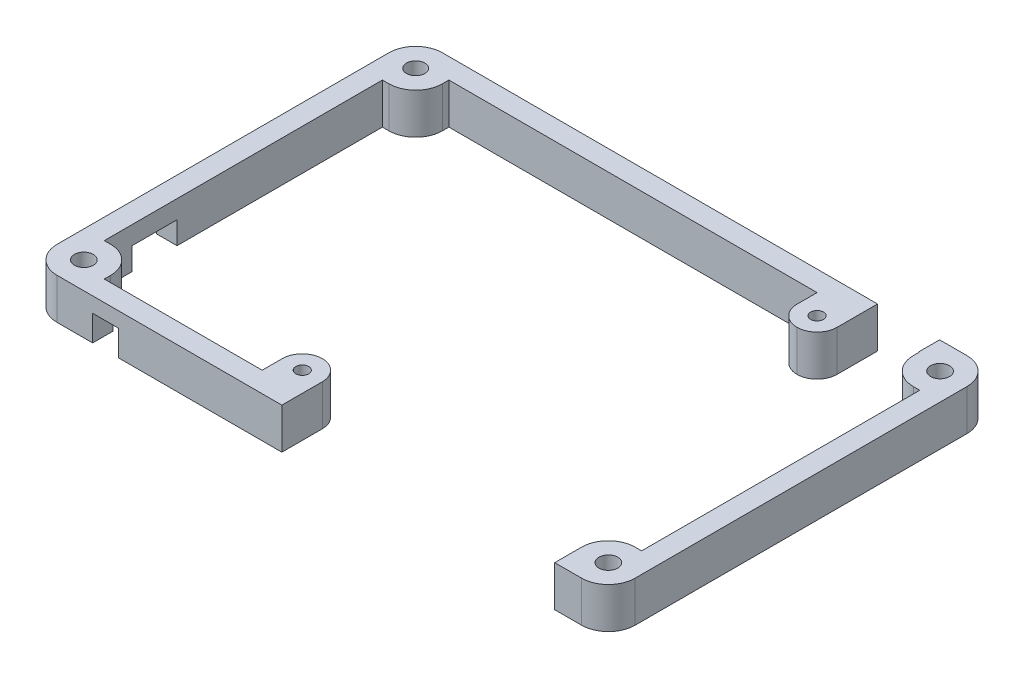
from build123d import *

# Parameters (mm, degrees)
BOSS_EXTRUDE3_DEPTH = 6.35
SKETCH3_W           = 9.663283239
SKETCH3_H           = 6.35
CUT_EXTRUDE1_DEPTH  = 3.175
SKETCH4_W           = 42.475
SKETCH4_H           = 6.35
CUT_EXTRUDE2_DEPTH  = 8.35
SKETCH5_W           = 7
SKETCH5_H           = 7
CUT_EXTRUDE3_DEPTH  = 3.175
SKETCH6_R           = 1.4732
CUT_EXTRUDE4_DEPTH  = 6.35
SKETCH7_R           = 1.4224
SKETCH7_R_2         = 1.4732
CUT_EXTRUDE5_DEPTH  = 6.35
SKETCH8_W           = 6.24
SKETCH8_H           = 6.35
BOSS_EXTRUDE4_DEPTH = 6.24
SKETCH9_W           = 6.24
SKETCH9_H           = 6.35
BOSS_EXTRUDE5_DEPTH = 6.24
SKETCH10_R          = 1
CUT_EXTRUDE6_DEPTH  = 55.454774814
FILLET1_R           = 3.12
SKETCH11_W          = 4
SKETCH11_H          = 4
CUT_EXTRUDE7_DEPTH  = 10


with BuildPart() as part:
    # Sketch2 → Boss-Extrude3 (new body)
    with BuildSketch(Plane(origin=(0, 0, 0), x_dir=(1, 0, 0), z_dir=(0, 1, 0))):
        with BuildLine():
            Line((-45, 25.825), (-45, -25.825))
            ThreePointArc((-45, -25.825), (-43.777170811, -28.777170811), (-40.825, -30))
            Line((-40.825, -30), (40.825, -30))
            ThreePointArc((40.825, -30), (43.777170811, -28.777170811), (45, -25.825))
            Line((45, -25.825), (45, 25.825))
            ThreePointArc((45, 25.825), (43.777170811, 28.777170811), (40.825, 30))
            Line((40.825, 30), (-40.825, 30))
            ThreePointArc((-40.825, 30), (-43.777170811, 28.777170811), (-45, 25.825))
        make_face()
        with BuildLine():
            Line((40.825, 21.65), (41.825, 21.65))
            Line((41.825, 21.65), (41.825, -21.65))
            Line((41.825, -21.65), (40.825, -21.65))
            ThreePointArc((40.825, -21.65), (37.872829189, -22.872829189), (36.65, -25.825))
            Line((36.65, -25.825), (36.65, -26.825))
            Line((36.65, -26.825), (-36.65, -26.825))
            Line((-36.65, -26.825), (-36.65, -25.825))
            ThreePointArc((-36.65, -25.825), (-37.872829189, -22.872829189), (-40.825, -21.65))
            Line((-40.825, -21.65), (-41.825, -21.65))
            Line((-41.825, -21.65), (-41.825, 21.65))
            Line((-41.825, 21.65), (-40.825, 21.65))
            ThreePointArc((-40.825, 21.65), (-37.872829189, 22.872829189), (-36.65, 25.825))
            Line((-36.65, 25.825), (-36.65, 26.825))
            Line((-36.65, 26.825), (36.65, 26.825))
            Line((36.65, 26.825), (36.65, 25.825))
            ThreePointArc((36.65, 25.825), (37.872829189, 22.872829189), (40.825, 21.65))
        make_face(mode=Mode.SUBTRACT)
    extrude(amount=BOSS_EXTRUDE3_DEPTH)

    # Sketch3 → Cut-Extrude1 (cut)
    with BuildSketch(Plane(origin=(0, 0, -30), x_dir=(-1, 0, 0), z_dir=(0, 0, -1))):
        with Locations((-31.734329903, 3.175)):
            Rectangle(SKETCH3_W, SKETCH3_H)
    extrude(amount=-CUT_EXTRUDE1_DEPTH, mode=Mode.SUBTRACT)

    # Sketch4 → Cut-Extrude2 (cut)
    with BuildSketch(Plane.XY.offset(30)):
        with Locations((15.4125, 3.175)):
            Rectangle(SKETCH4_W, SKETCH4_H)
    extrude(amount=-CUT_EXTRUDE2_DEPTH, mode=Mode.SUBTRACT)


with BuildPart() as cut_extrude2_piece_1:
    # of the separate pieces the step leaves, piece 1, a body of its own (cut_extrude2_pieces)
    add(part.part.solids().sort_by_distance((-40.825, 0, 30))[0])

    # Sketch5 → Cut-Extrude3 (cut)
    with BuildSketch(Plane.ZY.offset(45)):
        with Locations((13.825, 0)):
            Rectangle(SKETCH5_W, SKETCH5_H)
    extrude(amount=-CUT_EXTRUDE3_DEPTH, mode=Mode.SUBTRACT)

    # Sketch7 → Cut-Extrude5 (cut)
    with BuildSketch(Plane.XZ):
        with Locations(Location((-40.825, -25.825, 0), (0, 0, 270))):
            Circle(SKETCH7_R)
        with Locations(Location((-40.825, 25.825, 0), (0, 0, 270))):
            Circle(SKETCH7_R_2)
    extrude(amount=-CUT_EXTRUDE5_DEPTH, mode=Mode.SUBTRACT)

    # Sketch8 → Boss-Extrude4 (add)
    with BuildSketch(Plane(origin=(0, 0, 26.825), x_dir=(-1, 0, 0), z_dir=(0, 0, -1))):
        with Locations((8.945, 3.175)):
            Rectangle(SKETCH8_W, SKETCH8_H)
    extrude(amount=BOSS_EXTRUDE4_DEPTH)

    # Sketch9 → Boss-Extrude5 (add)
    with BuildSketch(Plane.XY.offset(-26.825)):
        with Locations((23.782688283, 3.175)):
            Rectangle(SKETCH9_W, SKETCH9_H)
    extrude(amount=BOSS_EXTRUDE5_DEPTH)

    # Sketch10 → Cut-Extrude6 (cut, through all)
    with BuildSketch(Plane(origin=(0, 0, 0), x_dir=(-1, 0, 0), z_dir=(0, -1, 0))):
        with Locations(Location((-23.782688283, 23.705, 0), (0, 0, 90))):
            Circle(SKETCH10_R)
        with Locations(Location((8.945, -23.705, 0), (0, 0, 90))):
            Circle(SKETCH10_R)
    extrude(amount=-CUT_EXTRUDE6_DEPTH, mode=Mode.SUBTRACT)

    # Fillet1
    fillet1_edges = [cut_extrude2_piece_1.edges().sort_by_distance(p)[0] for p in [
        (-12.065, 3.175, 20.585),
        (-5.825, 3.175, 20.585),
        (26.902688283, 3.175, -20.585),
        (20.662688283, 3.175, -20.585),
    ]]
    fillet(fillet1_edges, radius=FILLET1_R - 0.0001)  # a hair under: the kernel refuses the full size

    # Sketch11 → Cut-Extrude7 (cut)
    with BuildSketch(Plane.XY.offset(30)):
        with Locations((-33.285, 2)):
            Rectangle(SKETCH11_W, SKETCH11_H)
    extrude(amount=-CUT_EXTRUDE7_DEPTH, mode=Mode.SUBTRACT)


with BuildPart() as cut_extrude2_piece_2:
    # of the separate pieces the step leaves, piece 2, a body of its own (cut_extrude2_pieces)
    add(part.part.solids().sort_by_distance((40.825, 0, -30))[0])

    # Sketch6 → Cut-Extrude4 (cut)
    with BuildSketch(Plane.XZ):
        with Locations(Location((40.825, 25.825, 0), (0, 0, 270))):
            Circle(SKETCH6_R)
        with Locations(Location((40.825, -25.81487963, 0), (0, 0, 270))):
            Circle(SKETCH6_R)
    extrude(amount=-CUT_EXTRUDE4_DEPTH, mode=Mode.SUBTRACT)


solid = Compound([cut_extrude2_piece_1.part, cut_extrude2_piece_2.part])
